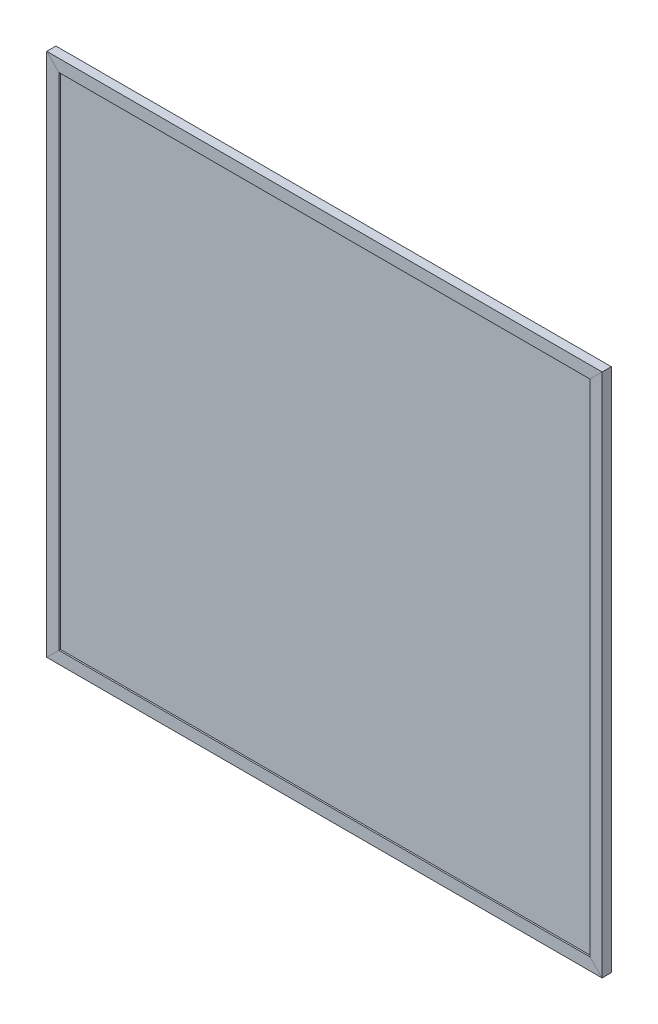
from build123d import *

# Parameters (mm, degrees)
SKETCH2_W               = 577.85
SKETCH2_H               = 546.1
BOSS_EXTRUDE1_DEPTH     = 4.7625
SKETCH3_W               = 552.45
SKETCH3_H               = 520.7
CUT_EXTRUDE1_DEPTH      = 789.794229346
CUT_EXTRUDE2_DEPTH      = 3.175
CUT_EXTRUDE2_DEPTH_BACK = 3.175
SKETCH4_W               = 574.675
SKETCH4_H               = 542.925
SPLIT1_START            = -4.7625
SPLIT1_DEPTH            = 1.5875
SPLIT1_START_2          = 3.175
SPLIT1_2_DEPTH          = 1.5875
SPLIT1_START_3          = -3.175
SPLIT1_3_DEPTH          = 6.35
SPLIT1_START_4          = -374.925693055
SPLIT1_4_OUTLINE_W      = 387.415821115
SPLIT1_4_OUTLINE_H      = 9.525
SPLIT1_4_DEPTH          = 776.792154473
SPLIT1_START_5          = 33.675960454
SPLIT1_5_OUTLINE_W      = 410.584178885
SPLIT1_5_OUTLINE_H      = 9.525
SPLIT1_5_DEPTH          = 386.151013206
SPLIT1_6_DEPTH          = 1.5875
SPLIT1_7_DEPTH          = 1.5875
SPLIT1_8_DEPTH          = 6.35
SPLIT1_9_DEPTH          = 1.5875
SPLIT1_10_DEPTH         = 1.5875
SPLIT1_11_DEPTH         = 6.35
SKETCH6_W               = 571.5
SKETCH6_H               = 539.75
BOSS_EXTRUDE2_DEPTH     = 3.175


# Read off the part's stored shape, not the designer's step: Split1
with BuildPart() as part:
    # Sketch2 → Boss-Extrude1 (new, symmetric)
    with BuildSketch(Plane.XY):
        with Locations((292.1, 260.35)):
            Rectangle(SKETCH2_W, SKETCH2_H)
    extrude(amount=BOSS_EXTRUDE1_DEPTH, both=True)

    # Sketch3 → Cut-Extrude1 (cut, through all)
    with BuildSketch(Plane.XY.offset(4.7625)):
        with Locations((292.1, 260.35)):
            Rectangle(SKETCH3_W, SKETCH3_H)
    extrude(amount=-CUT_EXTRUDE1_DEPTH, mode=Mode.SUBTRACT)

    # Sketch4 → Cut-Extrude2 (cut, two sides: drawn at the far end of the back side and taken through both)
    with BuildSketch(Plane.XY.offset(-CUT_EXTRUDE2_DEPTH_BACK)):
        with Locations((292.1, 260.35)):
            Rectangle(SKETCH4_W, SKETCH4_H)
    extrude(amount=CUT_EXTRUDE2_DEPTH + CUT_EXTRUDE2_DEPTH_BACK, mode=Mode.SUBTRACT)

    # Split1 4 outline → Split1 4 (cut)
    with BuildSketch(Plane(origin=(0, 0, 0), x_dir=(0.7071067811865474, 0.7071067811865477, 0), z_dir=(0.7071067811865476, -0.7071067811865476, 0)).offset(SPLIT1_START_4)):
        with Locations((185.707910558, 0)):
            Rectangle(SPLIT1_4_OUTLINE_W, SPLIT1_4_OUTLINE_H)
    extrude(amount=SPLIT1_4_DEPTH, mode=Mode.SUBTRACT)

    # Split1 5 outline → Split1 5 (cut)
    with BuildSketch(Plane(origin=(0, 0, 0), x_dir=(0.7071067811865474, 0.7071067811865477, 0), z_dir=(0.7071067811865476, -0.7071067811865476, 0)).offset(SPLIT1_START_5)):
        with Locations((584.707910557, 0)):
            Rectangle(SPLIT1_5_OUTLINE_W, SPLIT1_5_OUTLINE_H)
    extrude(amount=SPLIT1_5_DEPTH, mode=Mode.SUBTRACT)


with BuildPart() as body_2:
    # Split1 outline → Split1 (new body)
    with BuildSketch(Plane.XY.offset(SPLIT1_START)):
        Polygon((3.175, 533.4), (3.175, -12.7), (15.875, 0), (15.875, 520.7), align=None)
    extrude(amount=SPLIT1_DEPTH)

    # Split1 2 outline → Split1 2 (add)
    with BuildSketch(Plane.XY.offset(SPLIT1_START_2)):
        Polygon((3.175, 533.4), (3.175, -12.7), (15.875, 0), (15.875, 520.7), align=None)
    extrude(amount=SPLIT1_2_DEPTH)

    # Split1 3 outline → Split1 3 (add)
    with BuildSketch(Plane.XY.offset(SPLIT1_START_3)):
        Polygon((4.7625, 531.8125), (3.175, 533.4), (3.175, -12.7), (4.7625, -11.1125), align=None)
    extrude(amount=SPLIT1_3_DEPTH)


with BuildPart() as body_3:
    # Split1 6 outline → Split1 6 (new body)
    with BuildSketch(Plane.XY.offset(SPLIT1_START)):
        Polygon((581.025, -12.7), (581.025, 533.4), (568.325, 520.7), (568.325, 0), align=None)
    extrude(amount=SPLIT1_6_DEPTH)

    # Split1 7 outline → Split1 7 (add)
    with BuildSketch(Plane.XY.offset(SPLIT1_START_2)):
        Polygon((581.025, -12.7), (581.025, 533.4), (568.325, 520.7), (568.325, 0), align=None)
    extrude(amount=SPLIT1_7_DEPTH)

    # Split1 8 outline → Split1 8 (add)
    with BuildSketch(Plane.XY.offset(SPLIT1_START_3)):
        Polygon((579.4375, -11.1125), (581.025, -12.7), (581.025, 533.4), (579.4375, 531.8125), align=None)
    extrude(amount=SPLIT1_8_DEPTH)


with BuildPart() as body_4:
    # Split1 9 outline → Split1 9 (new body)
    with BuildSketch(Plane.XY.offset(SPLIT1_START)):
        Polygon((3.175, -12.7), (581.025, -12.7), (568.325, 0), (15.875, 0), align=None)
    extrude(amount=SPLIT1_9_DEPTH)

    # Split1 10 outline → Split1 10 (add)
    with BuildSketch(Plane.XY.offset(SPLIT1_START_2)):
        Polygon((3.175, -12.7), (581.025, -12.7), (568.325, 0), (15.875, 0), align=None)
    extrude(amount=SPLIT1_10_DEPTH)

    # Split1 11 outline → Split1 11 (add)
    with BuildSketch(Plane.XY.offset(SPLIT1_START_3)):
        Polygon((4.7625, -11.1125), (3.175, -12.7), (581.025, -12.7), (579.4375, -11.1125), align=None)
    extrude(amount=SPLIT1_11_DEPTH)


with BuildPart() as body_5:
    # Sketch6 → Boss-Extrude2 (new, symmetric)
    with BuildSketch(Plane.XY):
        with Locations((292.1, 260.35)):
            Rectangle(SKETCH6_W, SKETCH6_H)
    extrude(amount=BOSS_EXTRUDE2_DEPTH, both=True)


solid = Compound([part.part, body_2.part, body_3.part, body_4.part, body_5.part])
